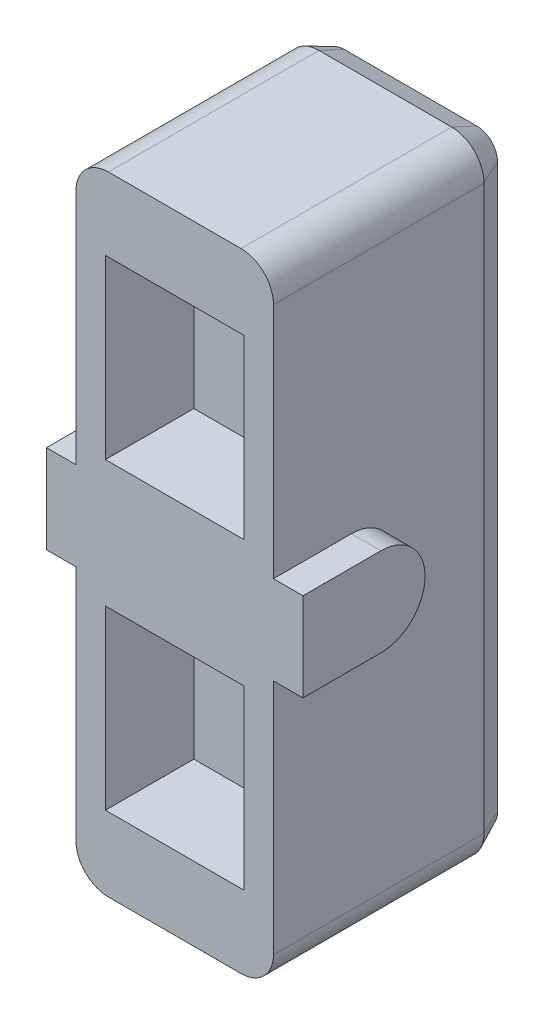
from build123d import *

# Parameters (mm, degrees)
BOSS_EXTRU_1_DEPTH      = 8
CHANFREIN1_SIZE         = 0.4
CHANFREIN1_SIZE2        = 0.857802768
ENL_V_MAT_EXTRU_3_DEPTH = 0.2
BOSS_EXTRU_2_DEPTH      = 0.2
BOSS_EXTRU_2_2_DEPTH    = 0.2
ESQUISSE3_W             = 4.7
ESQUISSE3_H             = 6
ENL_V_MAT_EXTRU_4_DEPTH = 3
BOSS_EXTRU_3_DEPTH      = 1
BOSS_EXTRU_3_DEPTH_BACK = 7.7


with BuildPart() as part:
    # Esquisse2 → Boss.-Extru.1 (new body)
    with BuildSketch(Plane.XY):
        with BuildLine():
            Line((1.1, 0), (5.6, 0))
            ThreePointArc((5.6, 0), (6.377817459, 0.322182541), (6.7, 1.1))
            Line((6.7, 1.1), (6.7, 20.2))
            ThreePointArc((6.7, 20.2), (6.377817459, 20.977817459), (5.6, 21.3))
            Line((5.6, 21.3), (1.1, 21.3))
            ThreePointArc((1.1, 21.3), (0.322182541, 20.977817459), (0, 20.2))
            Line((0, 20.2), (0, 1.1))
            ThreePointArc((0, 1.1), (0.322182541, 0.322182541), (1.1, 0))
        make_face()
    extrude(amount=BOSS_EXTRU_1_DEPTH)

    # Chanfrein1
    chanfrein1_edges = [part.edges().sort_by_distance(p)[0] for p in [
        (3.35, 0, 0),
        (6.377817459, 0.322182541, 0),
        (0.322182541, 0.322182541, 0),
        (6.7, 10.65, 0),
        (0, 10.65, 0),
        (6.377817459, 20.977817459, 0),
        (0.322182541, 20.977817459, 0),
        (3.35, 21.3, 0),
    ]]
    chanfrein1_side = [part.faces().sort_by_distance(p)[0] for p in [
        (3.35, 10.65, 0),
    ]]
    chamfer(chanfrein1_edges, length=CHANFREIN1_SIZE, length2=CHANFREIN1_SIZE2, reference=chanfrein1_side[0])

    # Esquisse5 → Enlèv. mat.-Extru.3 (cut)
    # profile 1 of 2: a face of its own
    with BuildSketch(Plane.XY):
        Polygon((1.54, 5.9), (5.159538913, 5.9), (3.349812525, 1.9), align=None)
        Polygon((3.349799516, 3.355553525), (2.47002862, 5.3), (4.22952854, 5.3), align=None, mode=Mode.SUBTRACT)
    # profile 2 of 2: a face of its own
    with BuildSketch(Plane.XY):
        Polygon((1.54, 15.4), (5.16, 15.4), (3.35, 19.4), align=None)
        Polygon((2.470068334, 16), (4.229931666, 16), (3.35, 17.944600368), align=None, mode=Mode.SUBTRACT)
    extrude(amount=ENL_V_MAT_EXTRU_3_DEPTH, mode=Mode.SUBTRACT)

    # Esquisse3 → Enlèv. mat.-Extru.4 (cut)
    with BuildSketch(Plane.XY.offset(8)):
        with Locations((3.35, 15.8)):
            Rectangle(ESQUISSE3_W, ESQUISSE3_H)
        with Locations((3.35, 5.5)):
            Rectangle(ESQUISSE3_W, ESQUISSE3_H)
    extrude(amount=-ENL_V_MAT_EXTRU_4_DEPTH, mode=Mode.SUBTRACT)

    # Esquisse6 → Boss.-Extru.3 (add, two sides: drawn at the far end of the back side and taken through both)
    with BuildSketch(Plane.ZY.offset(-BOSS_EXTRU_3_DEPTH_BACK)):
        with BuildLine():
            Line((5.357802768, 12.15), (8, 12.15))
            Line((8, 12.15), (8, 9.15))
            Line((8, 9.15), (5.357802768, 9.15))
            ThreePointArc((5.357802768, 9.15), (3.857802768, 10.65), (5.357802768, 12.15))
        make_face()
    extrude(amount=BOSS_EXTRU_3_DEPTH + BOSS_EXTRU_3_DEPTH_BACK)


with BuildPart() as body_2:
    # Esquisse5<4> → Boss.-Extru.2 (new body)
    with BuildSketch(Plane.XY):
        Polygon((1.54, 5.9), (5.159538913, 5.9), (3.349812525, 1.9), align=None)
        Polygon((3.349799516, 3.355553525), (2.47002862, 5.3), (4.22952854, 5.3), align=None, mode=Mode.SUBTRACT)
    extrude(amount=-BOSS_EXTRU_2_DEPTH)


with BuildPart() as body_3:
    # Esquisse5<4> → Boss.-Extru.2 2 (new body)
    with BuildSketch(Plane.XY):
        Polygon((1.54, 15.4), (5.16, 15.4), (3.35, 19.4), align=None)
        Polygon((2.470068334, 16), (4.229931666, 16), (3.35, 17.944600368), align=None, mode=Mode.SUBTRACT)
    extrude(amount=-BOSS_EXTRU_2_2_DEPTH)


solid = Compound([part.part, body_2.part, body_3.part])
